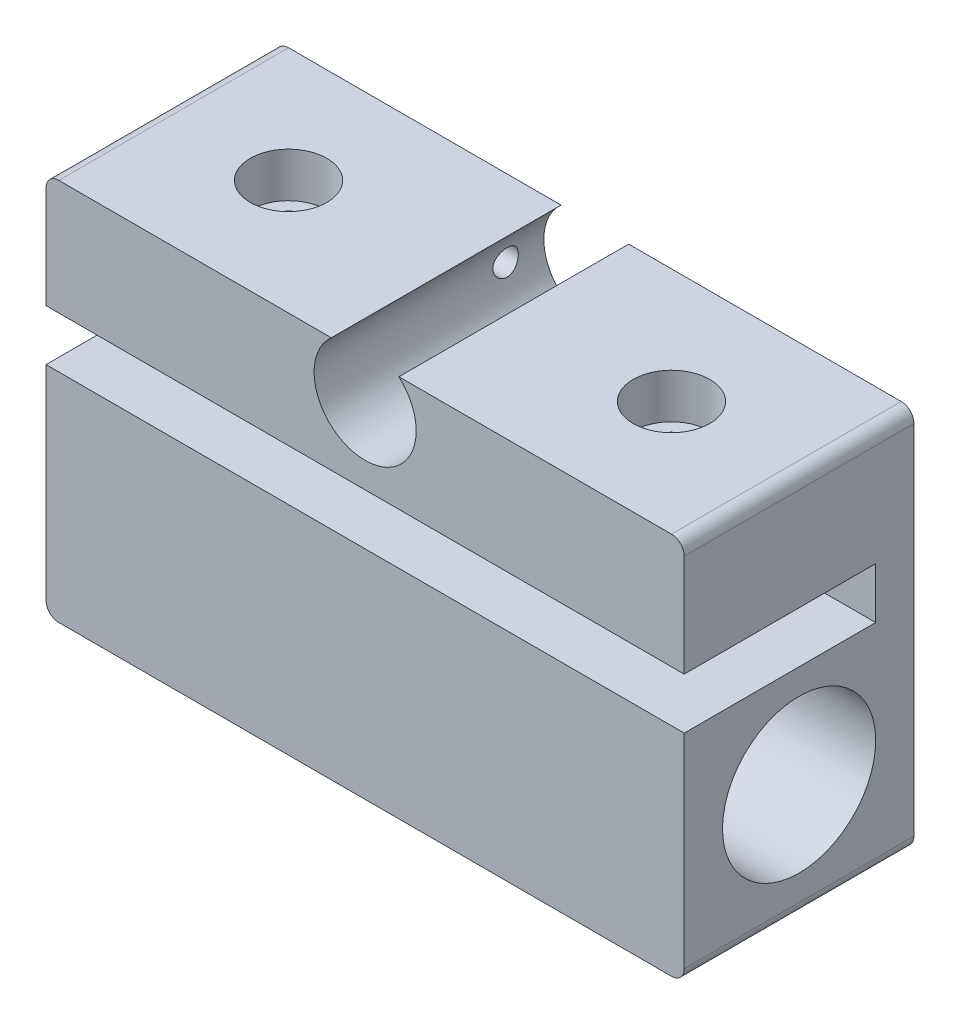
from build123d import *

# Parameters (mm, degrees)
SKETCH1_W                               = 50
SKETCH1_H                               = 30
BOSS_EXTRUDE1_DEPTH                     = 9
SKETCH2_R                               = 6
CUT_EXTRUDE1_DEPTH                      = 53.971690553
SKETCH3_R                               = 4
CUT_EXTRUDE2_DEPTH                      = 35.263683398
SKETCH4_W                               = 50
SKETCH4_H                               = 4
CUT_EXTRUDE3_DEPTH                      = 15
SKETCH5_R                               = 1
CUT_EXTRUDE4_DEPTH                      = 25
SKETCH6_R                               = 1.5
CUT_EXTRUDE5_DEPTH                      = 5
CUT_EXTRUDE6_REACH                      = 42.075
SKETCH7_R                               = 2
CBORE_FOR_M5_HEX_HEAD_BOLT1_D           = 4
CBORE_FOR_M5_HEX_HEAD_BOLT1_DEPTH       = 10
CBORE_FOR_M5_HEX_HEAD_BOLT1_CBORE_D     = 6
CBORE_FOR_M5_HEX_HEAD_BOLT1_CBORE_DEPTH = 3.5
CBORE_FOR_M5_HEX_HEAD_BOLT1_TIP         = 1.201721238
FILLET1_R                               = 1


with BuildPart() as part:
    # Sketch1 → Boss-Extrude1 (new, symmetric)
    with BuildSketch(Plane.XY):
        Rectangle(SKETCH1_W, SKETCH1_H)
    extrude(amount=BOSS_EXTRUDE1_DEPTH, both=True)

    # Sketch2 → Cut-Extrude1 (cut, through all)
    with BuildSketch(Plane.ZY.offset(25)):
        with Locations((0, -6)):
            Circle(SKETCH2_R)
    extrude(amount=-CUT_EXTRUDE1_DEPTH, mode=Mode.SUBTRACT)

    # Sketch3 → Cut-Extrude2 (cut, through all)
    with BuildSketch(Plane.XY.offset(9)):
        with Locations((0, 12)):
            Circle(SKETCH3_R)
    extrude(amount=-CUT_EXTRUDE2_DEPTH, mode=Mode.SUBTRACT)

    # Sketch4 → Cut-Extrude3 (cut)
    with BuildSketch(Plane.XY.offset(9)):
        with Locations((0, 4)):
            Rectangle(SKETCH4_W, SKETCH4_H)
    extrude(amount=-CUT_EXTRUDE3_DEPTH, mode=Mode.SUBTRACT)

    # Sketch5 → Cut-Extrude4 (cut)
    with BuildSketch(Plane.ZY.offset(25)):
        with Locations((-6, 12)):
            Circle(SKETCH5_R)
    extrude(amount=-CUT_EXTRUDE4_DEPTH, mode=Mode.SUBTRACT)

    # Sketch6 → Cut-Extrude5 (cut)
    with BuildSketch(Plane.ZY.offset(25)):
        with Locations((-6, 12)):
            Circle(SKETCH6_R)
    extrude(amount=-CUT_EXTRUDE5_DEPTH, mode=Mode.SUBTRACT)

    # Sketch7 → Cut-Extrude6 (cut, up to next)
    with BuildSketch(Plane(origin=(0, 15, 0), x_dir=(1, 0, 0), z_dir=(0, 1, 0)), mode=Mode.PRIVATE) as cut_extrude6_sk1:
        with Locations((-15, 0)):
            Circle(SKETCH7_R)
    cut_extrude6_tool1 = extrude(cut_extrude6_sk1.sketch, amount=-CUT_EXTRUDE6_REACH, mode=Mode.PRIVATE) & part.part
    # Sketch7 → Cut-Extrude6 (cut, up to next)
    with BuildSketch(Plane(origin=(0, 15, 0), x_dir=(1, 0, 0), z_dir=(0, 1, 0)), mode=Mode.PRIVATE) as cut_extrude6_sk2:
        with Locations((15, 0)):
            Circle(SKETCH7_R)
    cut_extrude6_tool2 = extrude(cut_extrude6_sk2.sketch, amount=-CUT_EXTRUDE6_REACH, mode=Mode.PRIVATE) & part.part
    add(cut_extrude6_tool1.solids().sort_by_distance((-15, 15, 0))[0], mode=Mode.SUBTRACT)
    add(cut_extrude6_tool2.solids().sort_by_distance((15, 15, 0))[0], mode=Mode.SUBTRACT)

    # CBORE for M5 Hex Head Bolt1
    with Locations(Plane(origin=(-15, 15, 0), x_dir=(0, 0, 1), z_dir=(0, 1, 0))):
        with Locations((0, 0), (0, 30)):
            CounterBoreHole(CBORE_FOR_M5_HEX_HEAD_BOLT1_D / 2, CBORE_FOR_M5_HEX_HEAD_BOLT1_CBORE_D / 2, CBORE_FOR_M5_HEX_HEAD_BOLT1_CBORE_DEPTH, depth=CBORE_FOR_M5_HEX_HEAD_BOLT1_DEPTH)
            with Locations((0, 0, -(CBORE_FOR_M5_HEX_HEAD_BOLT1_DEPTH + CBORE_FOR_M5_HEX_HEAD_BOLT1_TIP / 2))):  # 118° drill point
                Cone(0, CBORE_FOR_M5_HEX_HEAD_BOLT1_D / 2, CBORE_FOR_M5_HEX_HEAD_BOLT1_TIP, mode=Mode.SUBTRACT)

    # Fillet1
    fillet1_edges = [part.edges().sort_by_distance(p)[0] for p in [
        (-25, -15, 0),
        (25, -15, 0),
        (25, 15, 0),
        (-25, 15, 0),
    ]]
    fillet(fillet1_edges, radius=FILLET1_R)


solid = part.part
